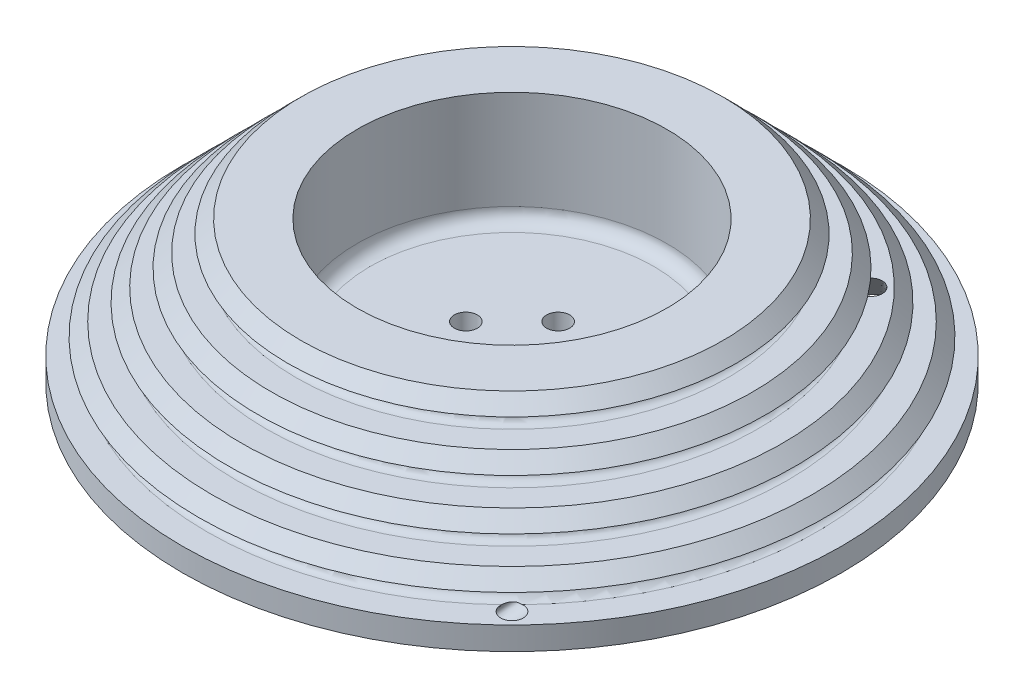
from build123d import *

# Parameters (mm, degrees)
FILLET1_R               = 1.25
SKETCH11_R              = 23.5
CUT_EXTRUDE2_DEPTH      = 17
FILLET2_R               = 2
BOSS_EXTRUDE1_START     = 0.5
SKETCH19_R              = 50
BOSS_EXTRUDE1_DEPTH     = 0.5
CUT_EXTRUDE1_DEPTH      = 0.5
CUT_EXTRUDE1_DEPTH_BACK = 74.907036201
SKETCH9_R               = 1.75
SKETCH20_R              = 2.6
CUT_EXTRUDE3_DEPTH      = 3
SKETCH8_R               = 1.7
SKETCH7_R               = 1.7


with BuildPart() as part:
    # Sketch1 → Revolve1 (revolve)
    with BuildSketch(Plane.XY, mode=Mode.PRIVATE) as revolve1_sk:
        Polygon((0, 0), (0, 21), (-32, 21), (-50, 3), (-50, 0), align=None)
    revolve(revolve1_sk.sketch.rotate(Axis((0, 0, 0), (0, 1, 0)), 270), axis=Axis((0, 0, 0), (0, 1, 0)))

    # Sketch2 → Cut-Revolve1 (revolve, cut)
    with BuildSketch(Plane.XY, mode=Mode.PRIVATE) as cut_revolve1_sk:
        Polygon((-45, 5.5), (-47.5, 5.5), (-50, 3), (-45, 3), align=None)
        Polygon((-31.5, 19), (-34, 19), (-36.5, 16.5), (-31.5, 16.5), align=None)
        Polygon((-40.5, 10), (-43, 10), (-45.5, 7.5), (-40.5, 7.5), align=None)
        Polygon((-36, 14.5), (-38.5, 14.5), (-41, 12), (-36, 12), align=None)
    revolve(cut_revolve1_sk.sketch.rotate(Axis((0, 0, 0), (0, 1, 0)), 270), axis=Axis((0, 0, 0), (0, 1, 0)), mode=Mode.SUBTRACT)

    # Fillet1
    fillet1_edges = [part.edges().sort_by_distance(p)[0] for p in [
        (0, 5.5, 45),
        (0, 3, 45),
        (0, 12, 36),
        (0, 14.5, 36),
        (0, 7.5, 40.5),
        (0, 10, 40.5),
        (0, 19, 31.5),
        (0, 16.5, 31.5),
    ]]
    fillet(fillet1_edges, radius=FILLET1_R - 0.0001)  # a hair under: the kernel refuses the full size

    # Sketch11 → Cut-Extrude2 (cut)
    with BuildSketch(Plane(origin=(0, 21, 0), x_dir=(1, 0, 0), z_dir=(0, 1, 0))):
        with Locations(Location((0, 0, 0), (0, 0, 270))):
            Circle(SKETCH11_R)
    extrude(amount=-CUT_EXTRUDE2_DEPTH, mode=Mode.SUBTRACT)

    # Fillet2
    fillet2_edges = [part.edges().sort_by_distance(p)[0] for p in [
        (0, 4, -23.5),
    ]]
    fillet(fillet2_edges, radius=FILLET2_R)

    # Sketch19 → Boss-Extrude1 (add)
    with BuildSketch(Plane.XZ.offset(BOSS_EXTRUDE1_START)):
        with Locations(Location((0, 0, 0), (0, 0, 270))):
            Circle(SKETCH19_R)
    extrude(amount=-BOSS_EXTRUDE1_DEPTH)

    # Sketch9 → Cut-Extrude1 (cut, two sides: drawn at the far end of the back side and taken through both)
    with BuildSketch(Plane.XZ.offset(0.5).offset(-CUT_EXTRUDE1_DEPTH_BACK)):
        with Locations(Location((-7, 0, 0), (0, 0, 90))):
            Circle(SKETCH9_R)
        with BuildLine():
            ThreePointArc((0, 8.75), (-1.75, 7), (0, 5.25))
            Line((0, 5.25), (0, 8.75))
        make_face()
        with BuildLine():
            Line((0, 8.75), (0, 5.25))
            ThreePointArc((0, 5.25), (1.237436867, 5.762563133), (1.75, 7))
            ThreePointArc((1.75, 7), (1.237436867, 8.237436867), (0, 8.75))
        make_face()
        with Locations(Location((7, 0, 0), (0, 0, 90))):
            Circle(SKETCH9_R)
        with Locations(Location((0, -7, 0), (0, 0, 90))):
            Circle(SKETCH9_R)
    extrude(amount=CUT_EXTRUDE1_DEPTH + CUT_EXTRUDE1_DEPTH_BACK, mode=Mode.SUBTRACT)

    # Sketch20 → Cut-Extrude3 (cut)
    with BuildSketch(Plane.XZ.offset(0.5)):
        with Locations(Location((0, 0, 0), (0, 0, 270))):
            Circle(SKETCH20_R)
    extrude(amount=-CUT_EXTRUDE3_DEPTH, mode=Mode.SUBTRACT)

    # Cut-Sweep1: sweep along a path in Sketch25
    with BuildLine(Plane(origin=(33.587572106, 0, 33.587572106), x_dir=(0.7071067811865476, 0, -0.7071067811865476), z_dir=(0.7071067811865476, 0, 0.7071067811865476))) as cut_sweep1_path:
        Line((1.489691991, 4.25), (-7.99759116, -3.710775793))
    # Sketch8 → Cut-Sweep1 (sweep, cut)
    with BuildSketch(Plane(origin=(0, 3, 0), x_dir=(1, 0, 0), z_dir=(0, 1, 0))):
        with Locations((33.587572106, -33.587572106)):
            Circle(SKETCH8_R)
    sweep(path=cut_sweep1_path.line, mode=Mode.SUBTRACT)

    # Cut-Sweep2: sweep along a path in Sketch24
    with BuildLine(Plane(origin=(27.811235607, 0, -26.609447082), x_dir=(0.6913229775943835, 0, 0.7225458744260018), z_dir=(-0.7225458744260018, 0, 0.6913229775943835))) as cut_sweep2_path:
        Line((-16.538499804, -1.380504084), (1.160999844, 13.7151539))
    # Sketch7 → Cut-Sweep2 (sweep, cut)
    with BuildSketch(Plane(origin=(0, 12, 0), x_dir=(1, 0, 0), z_dir=(0, 1, 0))):
        with Locations((27.223611076, 27.223611076)):
            Circle(SKETCH7_R)
    sweep(path=cut_sweep2_path.line, mode=Mode.SUBTRACT)


solid = part.part
